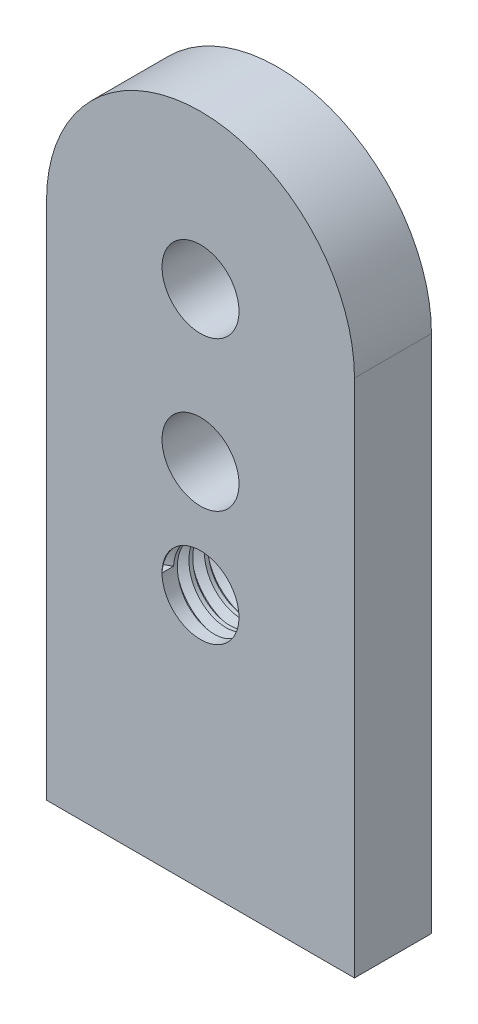
from build123d import *

# Parameters (mm, degrees)
SKETCH1_R           = 3.175
BOSS_EXTRUDE1_DEPTH = 3.175
THREAD1_PITCH       = 1.27


with BuildPart() as part:
    # Sketch1 → Boss-Extrude1 (new, symmetric)
    with BuildSketch(Plane.XY):
        with BuildLine():
            Line((-12.7, 0), (12.7, 0))
            Line((12.7, 0), (12.7, 42.8625))
            ThreePointArc((12.7, 42.8625), (0, 55.5625), (-12.7, 42.8625))
            Line((-12.7, 42.8625), (-12.7, 0))
        make_face()
        with Locations((0, 42.8625)):
            Circle(SKETCH1_R, mode=Mode.SUBTRACT)
        with Locations((0, 21.0058)):
            Circle(SKETCH1_R, mode=Mode.SUBTRACT)
        with Locations((0, 30.5308)):
            Circle(SKETCH1_R, mode=Mode.SUBTRACT)
    extrude(amount=BOSS_EXTRUDE1_DEPTH, both=True)

    # Thread1: the profile of Thread Profile1 profile screwed along a right-hand helix of 5 turns, 8 arcs to a turn; built about Z, then put on its axis
    thread1_z = Axis((0, 0, 0), (0, 0, 1))
    thread1_corners = [(3.1747, 0, -0.000173205), (3.862407661, 0, 0.396874998), (3.862407661, 0, 0.555624998), (3.1747, 0, 0.952673202)]
    with BuildLine(mode=Mode.PRIVATE) as thread1_profile:
        Line(thread1_corners[0], thread1_corners[1])
        Line(thread1_corners[1], thread1_corners[2])
        Line(thread1_corners[2], thread1_corners[3])
        Line(thread1_corners[3], thread1_corners[0])
    thread1_cap = Face(thread1_profile.wire())
    thread1_turn_angles = [0, 22.5, 45, 67.5, 90, 112.5, 135, 157.5, 180, 202.5, 225, 247.5, 270, 292.5, 315, 337.5, 360]
    thread1_turn_weights = [1, 0.9238795325112867, 1, 0.9238795325112867, 1, 0.9238795325112867, 1, 0.9238795325112867, 1, 0.9238795325112867, 1, 0.9238795325112867, 1, 0.9238795325112867, 1, 0.9238795325112867, 1]
    thread1_turn_rails = [Edge.make_bspline([Vector(p[0], p[1], 0).rotate(thread1_z, thread1_turn_angles[k]) / thread1_turn_weights[k] + Vector(0, 0, p[2] + THREAD1_PITCH * thread1_turn_angles[k] / 360) for k in range(17)], [0, 0, 0, 1, 1, 2, 2, 3, 3, 4, 4, 5, 5, 6, 6, 7, 7, 8, 8, 8], 2, thread1_turn_weights) for p in thread1_corners]
    thread1_turn_sides = [Face.make_surface_from_curves(thread1_turn_rails[p[0]], thread1_turn_rails[p[1]]) for p in [(0, 1), (1, 2), (2, 3), (3, 0)]]
    thread1 = Plane(origin=(0, 21.0058, 3.175), x_dir=(-1, 0, 0), z_dir=(0, 0, -1)) * Solid(Shell([*[p.moved(Location((0, 0, THREAD1_PITCH * i))) for i in range(5) for p in thread1_turn_sides], thread1_cap, thread1_cap.rotate(thread1_z, 1800).moved(Location((0, 0, THREAD1_PITCH * 1800 / 360)))]))
    add(thread1, mode=Mode.SUBTRACT)


solid = part.part
